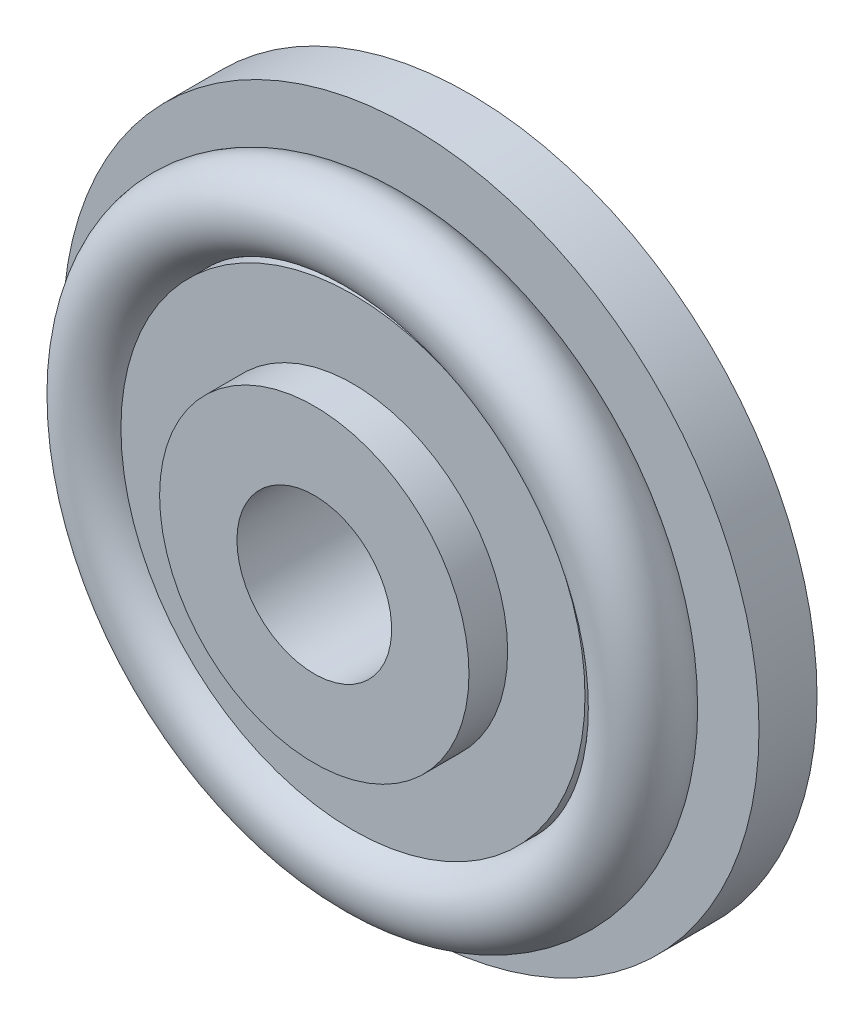
from build123d import *

# Parameters (mm, degrees)
HOLE_WIZARD_10_0_10_1_D = 8
SKETCH_7_R              = 2


with BuildPart() as part:
    # 草图1 → 旋转1 (revolve)
    with BuildSketch(Plane(origin=(0, 0, 0), x_dir=(1, 0, 0), z_dir=(0, 1, 0))):
        Polygon((0, 8), (18, 8), (18, 5), (12, 5), (12, 2), (8, 2), (8, 0), (0, 0), align=None)
    revolve(axis=Axis((0, 0, 0), (0, 0, -1)))

    # Ø10.0 (10) 直径孔1 (through all)
    with Locations(Plane(origin=(0, 0, -8), x_dir=(-1, 0, 0), z_dir=(0, 0, -1))):
        with Locations((0, 0)):
            Hole(HOLE_WIZARD_10_0_10_1_D / 2)


with BuildPart() as body_2:
    # 草图7 → 旋转2 (revolve)
    with BuildSketch(Plane(origin=(0, 0, 0), x_dir=(1, 0, 0), z_dir=(0, 1, 0))):
        with Locations((14, 3)):
            Circle(SKETCH_7_R)
    revolve(axis=Axis((0, 0, 0), (0, 0, 1)))


solid = Compound([part.part, body_2.part])
